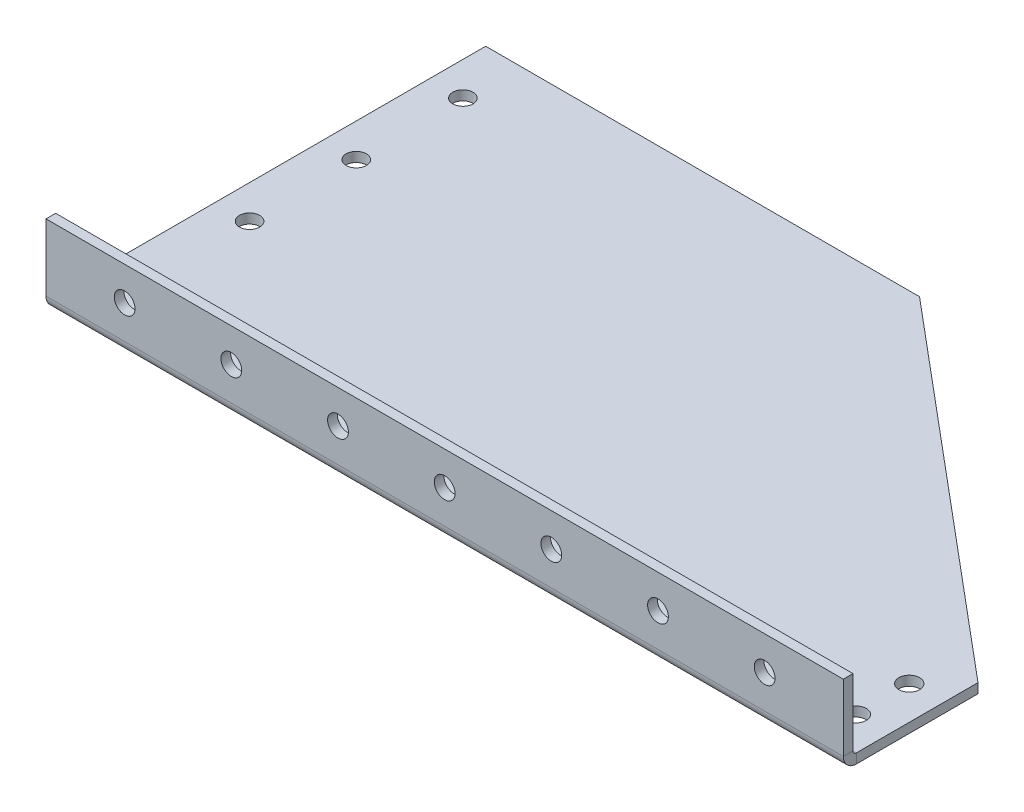
from build123d import *

# Parameters (mm, degrees)
SKETCH1_W                    = 189.8572
SKETCH1_H                    = 175.514
BASE_FLANGE1_DEPTH           = 2.3
EDGE_FLANGE4_STRIP_W         = 10.8256
EDGE_FLANGE4_STRIP_H         = 2.3
EDGE_FLANGE4_STRIP_CUT_DEPTH = 189.8572
EDGE_FLANGE4_DEPTH           = 189.8572
CUT_EXTRUDE1_DEPTH           = 144.797004807
CUT_EXTRUDE5_REACH           = 150.616
SKETCH41_R                   = 2.4765
CUT_EXTRUDE6_REACH           = 137.965
SKETCH42_R                   = 2.413
SKETCH42_R_2                 = 2.4765


# Sheet-metal steps are written as plain solids
with BuildPart() as part:
    # Sketch1 → Base-Flange1 (new body)
    with BuildSketch(Plane(origin=(0, 0, 0), x_dir=(1, 0, 0), z_dir=(0, 1, 0))):
        with Locations((11.4698, 7.08)):
            Rectangle(SKETCH1_W, SKETCH1_H)
    extrude(amount=-BASE_FLANGE1_DEPTH)

    # Edge-Flange4 strip (across the edge) → Edge-Flange4 strip cut (cut)
    with BuildSketch(Plane(origin=(-83.4588, 0, 80.677), x_dir=(0, 0, -1), z_dir=(1, 0, 0))):
        with Locations((-4.6, -1.15)):
            Rectangle(EDGE_FLANGE4_STRIP_W, EDGE_FLANGE4_STRIP_H)
    extrude(amount=EDGE_FLANGE4_STRIP_CUT_DEPTH, mode=Mode.SUBTRACT)

    # Edge-Flange4 section (across the edge) → Edge-Flange4 (add)
    with BuildSketch(Plane(origin=(-83.4588, 0, 80.677), x_dir=(0, 0, -1), z_dir=(1, 0, 0))):
        with BuildLine():
            Line((-2.3, 0.8128), (-2.3, 16.75))
            Line((-2.3, 16.75), (0, 16.75))
            Line((0, 16.75), (0, 0.8128))
            ThreePointArc((0, 0.8128), (0.238063608, 0.238063608), (0.8128, 0))
            Line((0.8128, 0), (0.8128, -2.3))
            ThreePointArc((0.8128, -2.3), (-1.388281988, -1.388281988), (-2.3, 0.8128))
        make_face()
    extrude(amount=EDGE_FLANGE4_DEPTH)

    # Sketch36 → Cut-Extrude1 (cut, through all)
    with BuildSketch(Plane.XZ.offset(2.3)):
        Polygon((19.845566889, -21.7218), (-83.4588, -21.7218), (-83.4588, -94.837), (106.3984, -94.837), (106.3984, 50.90465034), align=None)
    extrude(amount=-CUT_EXTRUDE1_DEPTH, mode=Mode.SUBTRACT)

    # Sketch41 → Cut-Extrude5 (cut, up to next)
    with BuildSketch(Plane(origin=(0, 0, 80.677), x_dir=(-1, 0, 0), z_dir=(0, 0, -1)), mode=Mode.PRIVATE) as cut_extrude5_sk1:
        with Locations(Location((64.7302, 8.7814, 0), (0, 0, 90))):
            Circle(SKETCH41_R)
    cut_extrude5_tool1 = extrude(cut_extrude5_sk1.sketch, amount=-CUT_EXTRUDE5_REACH, mode=Mode.PRIVATE) & part.part
    # Sketch41 → Cut-Extrude5 (cut, up to next)
    with BuildSketch(Plane(origin=(0, 0, 80.677), x_dir=(-1, 0, 0), z_dir=(0, 0, -1)), mode=Mode.PRIVATE) as cut_extrude5_sk2:
        with Locations(Location((39.3302, 8.7814, 0), (0, 0, 90))):
            Circle(SKETCH41_R)
    cut_extrude5_tool2 = extrude(cut_extrude5_sk2.sketch, amount=-CUT_EXTRUDE5_REACH, mode=Mode.PRIVATE) & part.part
    # Sketch41 → Cut-Extrude5 (cut, up to next)
    with BuildSketch(Plane(origin=(0, 0, 80.677), x_dir=(-1, 0, 0), z_dir=(0, 0, -1)), mode=Mode.PRIVATE) as cut_extrude5_sk3:
        with Locations(Location((13.9302, 8.7814, 0), (0, 0, 90))):
            Circle(SKETCH41_R)
    cut_extrude5_tool3 = extrude(cut_extrude5_sk3.sketch, amount=-CUT_EXTRUDE5_REACH, mode=Mode.PRIVATE) & part.part
    # Sketch41 → Cut-Extrude5 (cut, up to next)
    with BuildSketch(Plane(origin=(0, 0, 80.677), x_dir=(-1, 0, 0), z_dir=(0, 0, -1)), mode=Mode.PRIVATE) as cut_extrude5_sk4:
        with Locations(Location((-11.4698, 8.7814, 0), (0, 0, 90))):
            Circle(SKETCH41_R)
    cut_extrude5_tool4 = extrude(cut_extrude5_sk4.sketch, amount=-CUT_EXTRUDE5_REACH, mode=Mode.PRIVATE) & part.part
    # Sketch41 → Cut-Extrude5 (cut, up to next)
    with BuildSketch(Plane(origin=(0, 0, 80.677), x_dir=(-1, 0, 0), z_dir=(0, 0, -1)), mode=Mode.PRIVATE) as cut_extrude5_sk5:
        with Locations(Location((-36.8698, 8.7814, 0), (0, 0, 90))):
            Circle(SKETCH41_R)
    cut_extrude5_tool5 = extrude(cut_extrude5_sk5.sketch, amount=-CUT_EXTRUDE5_REACH, mode=Mode.PRIVATE) & part.part
    # Sketch41 → Cut-Extrude5 (cut, up to next)
    with BuildSketch(Plane(origin=(0, 0, 80.677), x_dir=(-1, 0, 0), z_dir=(0, 0, -1)), mode=Mode.PRIVATE) as cut_extrude5_sk6:
        with Locations(Location((-62.2698, 8.7814, 0), (0, 0, 90))):
            Circle(SKETCH41_R)
    cut_extrude5_tool6 = extrude(cut_extrude5_sk6.sketch, amount=-CUT_EXTRUDE5_REACH, mode=Mode.PRIVATE) & part.part
    # Sketch41 → Cut-Extrude5 (cut, up to next)
    with BuildSketch(Plane(origin=(0, 0, 80.677), x_dir=(-1, 0, 0), z_dir=(0, 0, -1)), mode=Mode.PRIVATE) as cut_extrude5_sk7:
        with Locations(Location((-87.6698, 8.7814, 0), (0, 0, 90))):
            Circle(SKETCH41_R)
    cut_extrude5_tool7 = extrude(cut_extrude5_sk7.sketch, amount=-CUT_EXTRUDE5_REACH, mode=Mode.PRIVATE) & part.part
    add(cut_extrude5_tool1.solids().sort_by_distance((-64.7302, 8.7814, 80.677))[0], mode=Mode.SUBTRACT)
    add(cut_extrude5_tool2.solids().sort_by_distance((-39.3302, 8.7814, 80.677))[0], mode=Mode.SUBTRACT)
    add(cut_extrude5_tool3.solids().sort_by_distance((-13.9302, 8.7814, 80.677))[0], mode=Mode.SUBTRACT)
    add(cut_extrude5_tool4.solids().sort_by_distance((11.4698, 8.7814, 80.677))[0], mode=Mode.SUBTRACT)
    add(cut_extrude5_tool5.solids().sort_by_distance((36.8698, 8.7814, 80.677))[0], mode=Mode.SUBTRACT)
    add(cut_extrude5_tool6.solids().sort_by_distance((62.2698, 8.7814, 80.677))[0], mode=Mode.SUBTRACT)
    add(cut_extrude5_tool7.solids().sort_by_distance((87.6698, 8.7814, 80.677))[0], mode=Mode.SUBTRACT)

    # Sketch42 → Cut-Extrude6 (cut, up to next)
    with BuildSketch(Plane(origin=(0, 0, 0), x_dir=(1, 0, 0), z_dir=(0, 1, 0)), mode=Mode.PRIVATE) as cut_extrude6_sk1:
        with Locations(Location((-75.4832, 8.3218, 0), (0, 0, 270))):
            Circle(SKETCH42_R)
    cut_extrude6_tool1 = extrude(cut_extrude6_sk1.sketch, amount=-CUT_EXTRUDE6_REACH, mode=Mode.PRIVATE) & part.part
    # Sketch42 → Cut-Extrude6 (cut, up to next)
    with BuildSketch(Plane(origin=(0, 0, 0), x_dir=(1, 0, 0), z_dir=(0, 1, 0)), mode=Mode.PRIVATE) as cut_extrude6_sk2:
        with Locations(Location((-75.4832, -17.0782, 0), (0, 0, 270))):
            Circle(SKETCH42_R)
    cut_extrude6_tool2 = extrude(cut_extrude6_sk2.sketch, amount=-CUT_EXTRUDE6_REACH, mode=Mode.PRIVATE) & part.part
    # Sketch42 → Cut-Extrude6 (cut, up to next)
    with BuildSketch(Plane(origin=(0, 0, 0), x_dir=(1, 0, 0), z_dir=(0, 1, 0)), mode=Mode.PRIVATE) as cut_extrude6_sk3:
        with Locations(Location((-75.4832, -42.4782, 0), (0, 0, 270))):
            Circle(SKETCH42_R)
    cut_extrude6_tool3 = extrude(cut_extrude6_sk3.sketch, amount=-CUT_EXTRUDE6_REACH, mode=Mode.PRIVATE) & part.part
    # Sketch42 → Cut-Extrude6 (cut, up to next)
    with BuildSketch(Plane(origin=(0, 0, 0), x_dir=(1, 0, 0), z_dir=(0, 1, 0)), mode=Mode.PRIVATE) as cut_extrude6_sk4:
        with Locations(Location((-75.4832, -67.8782, 0), (0, 0, 270))):
            Circle(SKETCH42_R)
    cut_extrude6_tool4 = extrude(cut_extrude6_sk4.sketch, amount=-CUT_EXTRUDE6_REACH, mode=Mode.PRIVATE) & part.part
    # Sketch42 → Cut-Extrude6 (cut, up to next)
    with BuildSketch(Plane(origin=(0, 0, 0), x_dir=(1, 0, 0), z_dir=(0, 1, 0)), mode=Mode.PRIVATE) as cut_extrude6_sk5:
        with Locations(Location((98.4228, -59.3042, 0), (0, 0, 270))):
            Circle(SKETCH42_R_2)
    cut_extrude6_tool5 = extrude(cut_extrude6_sk5.sketch, amount=-CUT_EXTRUDE6_REACH, mode=Mode.PRIVATE) & part.part
    # Sketch42 → Cut-Extrude6 (cut, up to next)
    with BuildSketch(Plane(origin=(0, 0, 0), x_dir=(1, 0, 0), z_dir=(0, 1, 0)), mode=Mode.PRIVATE) as cut_extrude6_sk6:
        with Locations(Location((98.4228, -72.0042, 0), (0, 0, 270))):
            Circle(SKETCH42_R_2)
    cut_extrude6_tool6 = extrude(cut_extrude6_sk6.sketch, amount=-CUT_EXTRUDE6_REACH, mode=Mode.PRIVATE) & part.part
    add(cut_extrude6_tool1.solids().sort_by_distance((-75.4832, 0, -8.3218))[0], mode=Mode.SUBTRACT)
    add(cut_extrude6_tool2.solids().sort_by_distance((-75.4832, 0, 17.0782))[0], mode=Mode.SUBTRACT)
    add(cut_extrude6_tool3.solids().sort_by_distance((-75.4832, 0, 42.4782))[0], mode=Mode.SUBTRACT)
    add(cut_extrude6_tool4.solids().sort_by_distance((-75.4832, 0, 67.8782))[0], mode=Mode.SUBTRACT)
    add(cut_extrude6_tool5.solids().sort_by_distance((98.4228, 0, 59.3042))[0], mode=Mode.SUBTRACT)
    add(cut_extrude6_tool6.solids().sort_by_distance((98.4228, 0, 72.0042))[0], mode=Mode.SUBTRACT)


solid = part.part
